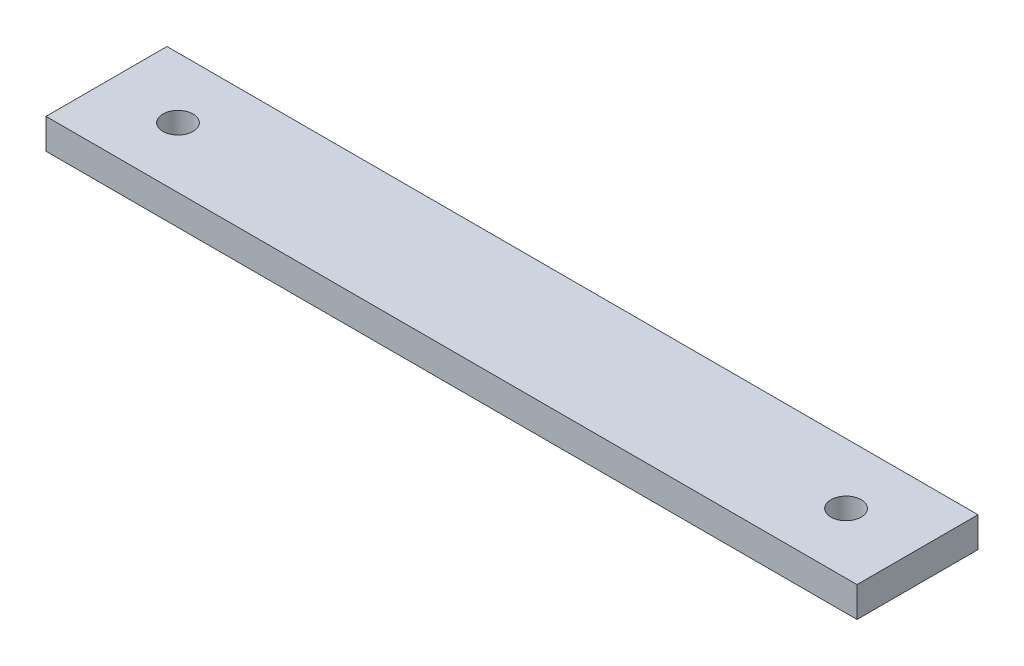
from build123d import *

# Parameters (mm, degrees)
SKETCH1_W           = 170.2562
SKETCH1_H           = 25.4
BOSS_EXTRUDE1_DEPTH = 6.35
CUT_EXTRUDE1_REACH  = 88.304
SKETCH2_R           = 3.175


with BuildPart() as part:
    # Sketch1 → Boss-Extrude1 (new body)
    with BuildSketch(Plane(origin=(0, 0, 0), x_dir=(1, 0, 0), z_dir=(0, 1, 0))):
        Rectangle(SKETCH1_W, SKETCH1_H)
    extrude(amount=BOSS_EXTRUDE1_DEPTH)

    # Sketch2 → Cut-Extrude1 (cut, up to next)
    with BuildSketch(Plane.XZ, mode=Mode.PRIVATE) as cut_extrude1_sk1:
        with Locations((-70.1167, 0)):
            Circle(SKETCH2_R)
    cut_extrude1_tool1 = extrude(cut_extrude1_sk1.sketch, amount=-CUT_EXTRUDE1_REACH, mode=Mode.PRIVATE) & part.part
    # Sketch2 → Cut-Extrude1 (cut, up to next)
    with BuildSketch(Plane.XZ, mode=Mode.PRIVATE) as cut_extrude1_sk2:
        with Locations((70.1281, 0)):
            Circle(SKETCH2_R)
    cut_extrude1_tool2 = extrude(cut_extrude1_sk2.sketch, amount=-CUT_EXTRUDE1_REACH, mode=Mode.PRIVATE) & part.part
    add(cut_extrude1_tool1.solids().sort_by_distance((-70.1167, 0, 0))[0], mode=Mode.SUBTRACT)
    add(cut_extrude1_tool2.solids().sort_by_distance((70.1281, 0, 0))[0], mode=Mode.SUBTRACT)


solid = part.part
